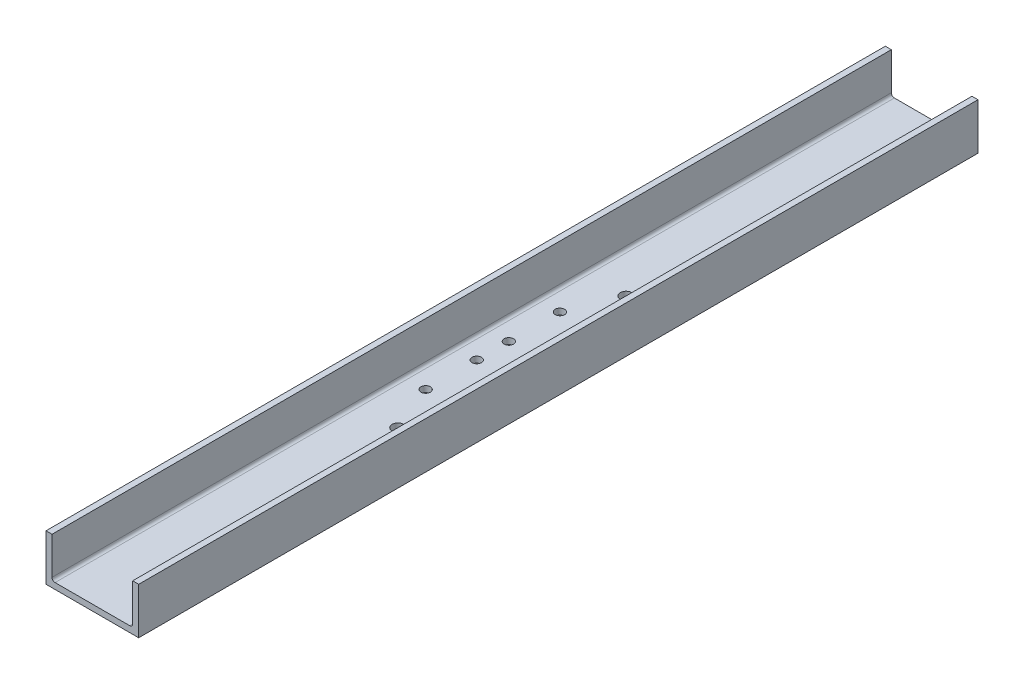
from build123d import *

# Parameters (mm, degrees)
BOSS_EXTRUDE1_DEPTH = 230
FILLET1_R           = 1.651
SKETCH4_R           = 2.585
CUT_EXTRUDE1_DEPTH  = 10
SKETCH5_R           = 3.18
CUT_EXTRUDE2_DEPTH  = 233.451030551


with BuildPart() as part:
    # Sketch3 → Boss-Extrude1 (new, symmetric)
    with BuildSketch(Plane.XY):
        Polygon((-25.4, 12.7), (-25.4, -12.7), (25.4, -12.7), (25.4, 12.7), (22.098, 12.7), (22.098, -9.398), (-22.098, -9.398), (-22.098, 12.7), align=None)
    extrude(amount=BOSS_EXTRUDE1_DEPTH, both=True)

    # Fillet1
    fillet1_edges = [part.edges().sort_by_distance(p)[0] for p in [
        (22.098, -9.398, 0),
        (-22.098, -9.398, 0),
    ]]
    fillet(fillet1_edges, radius=FILLET1_R)

    # Sketch4 → Cut-Extrude1 (cut)
    with BuildSketch(Plane(origin=(0, -9.398, 0), x_dir=(1, 0, 0), z_dir=(0, 1, 0))):
        with Locations((-10.530435142, 8.79)):
            Circle(SKETCH4_R)
        with Locations((10.469564858, 8.79)):
            Circle(SKETCH4_R)
        with Locations((-10.530435142, 36.79)):
            Circle(SKETCH4_R)
        with Locations((10.469564858, 36.79)):
            Circle(SKETCH4_R)
        with Locations((-10.530435142, -36.79)):
            Circle(SKETCH4_R)
        with Locations((10.469564858, -36.79)):
            Circle(SKETCH4_R)
        with Locations((10.469564858, -8.79)):
            Circle(SKETCH4_R)
        with Locations((-10.530435142, -8.79)):
            Circle(SKETCH4_R)
    extrude(amount=-CUT_EXTRUDE1_DEPTH, mode=Mode.SUBTRACT)

    # Sketch5 → Cut-Extrude2 (cut, through all)
    with BuildSketch(Plane(origin=(0, -9.398, 0), x_dir=(1, 0, 0), z_dir=(0, 1, 0))):
        with Locations((0, 62.521391607)):
            Circle(SKETCH5_R)
        with Locations((0, -62.52)):
            Circle(SKETCH5_R)
    extrude(amount=-CUT_EXTRUDE2_DEPTH, mode=Mode.SUBTRACT)


solid = part.part
